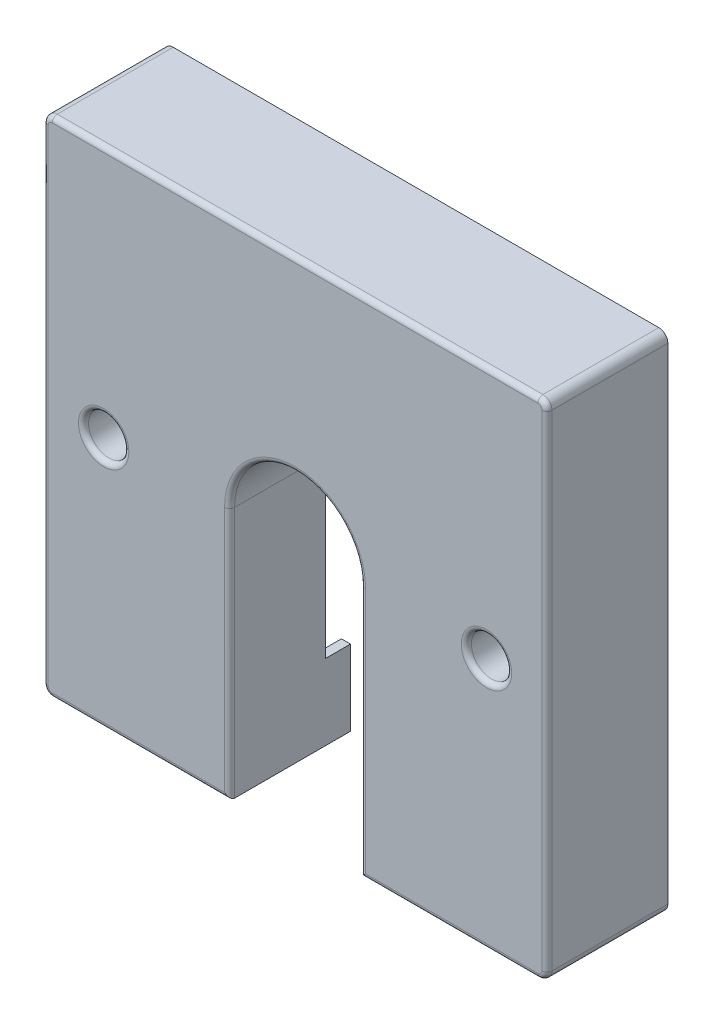
from build123d import *

# Parameters (mm, degrees)
SKETCH1_W           = 100
SKETCH1_H           = 100
BOSS_EXTRUDE1_DEPTH = 24
CUT_EXTRUDE1_DEPTH  = 127.818483233
CUT_EXTRUDE2_DEPTH  = 22
HOLE1_D             = 4
HOLE1_DEPTH         = 40
HOLE1_CBORE_D       = 8
HOLE1_CBORE_DEPTH   = 20
FILLET5_R           = 1
FILLET6_R           = 1
FILLET7_R           = 1.8
SKETCH10_W          = 46.470939908
SKETCH10_H          = 57.057613345
CUT_EXTRUDE4_DEPTH  = 5
FILLET8_R           = 1


with BuildPart() as part:
    # Sketch1 → Boss-Extrude1 (new body)
    with BuildSketch(Plane.XY.offset(121.301148811)):
        with Locations((24.455072694, 49.816681169)):
            Rectangle(SKETCH1_W, SKETCH1_H)
    extrude(amount=-BOSS_EXTRUDE1_DEPTH)

    # Sketch2 → Cut-Extrude1 (cut, through all)
    with BuildSketch(Plane(origin=(0, 0, 97.301148811), x_dir=(-1, 0, 0), z_dir=(0, 0, -1))):
        with BuildLine():
            Line((-37.455072694, -0.183318831), (-11.455072694, -0.183318831))
            Line((-11.455072694, -0.183318831), (-11.455072694, 49.816681169))
            ThreePointArc((-11.455072694, 49.816681169), (-24.455072694, 62.816681169), (-37.455072694, 49.816681169))
            Line((-37.455072694, 49.816681169), (-37.455072694, -0.183318831))
        make_face()
    extrude(amount=-CUT_EXTRUDE1_DEPTH, mode=Mode.SUBTRACT)

    # Sketch3 → Cut-Extrude2 (cut)
    with BuildSketch(Plane(origin=(0, 0, 97.301148811), x_dir=(-1, 0, 0), z_dir=(0, 0, -1))):
        with BuildLine():
            Line((-39.255072694, 1.616681169), (-39.255072694, 49.616681169))
            ThreePointArc((-39.255072694, 49.616681169), (-24.455072694, 64.416681169), (-9.655072694, 49.616681169))
            Line((-9.655072694, 49.616681169), (-9.655072694, 1.616681169))
            Line((-9.655072694, 1.616681169), (23.744927306, 1.616681169))
            Line((23.744927306, 1.616681169), (23.744927306, 98.016681169))
            Line((23.744927306, 98.016681169), (-72.655072694, 98.016681169))
            Line((-72.655072694, 98.016681169), (-72.655072694, 1.616681169))
            Line((-72.655072694, 1.616681169), (-39.255072694, 1.616681169))
        make_face()
    extrude(amount=-CUT_EXTRUDE2_DEPTH, mode=Mode.SUBTRACT)

    # Sketch4 → Revolve1 (revolve)
    with BuildSketch(Plane.XZ.offset(-49.816681169), mode=Mode.PRIVATE) as revolve1_sk:
        with BuildLine():
            Line((71.455072694, 120.301148811), (62.455072694, 120.301148811))
            Line((62.455072694, 120.301148811), (62.455072694, 97.301148811))
            Line((62.455072694, 97.301148811), (67.455072694, 97.301148811))
            Line((67.455072694, 97.301148811), (67.455072694, 116.301148811))
            ThreePointArc((67.455072694, 116.301148811), (68.626645569, 119.129575936), (71.455072694, 120.301148811))
        make_face()
    revolve(revolve1_sk.sketch.rotate(Axis((62.455072694, 49.816681169, 120.301148811), (0, 0, -1)), 180), axis=Axis((62.455072694, 49.816681169, 120.301148811), (0, 0, -1)))

    # Sketch5 → Revolve2 (revolve)
    with BuildSketch(Plane.XZ.offset(-49.816681169), mode=Mode.PRIVATE) as revolve2_sk:
        with BuildLine():
            Line((-4.544927306, 120.301148811), (-13.544927306, 120.301148811))
            Line((-13.544927306, 120.301148811), (-13.544927306, 97.301148811))
            Line((-13.544927306, 97.301148811), (-8.544927306, 97.301148811))
            Line((-8.544927306, 97.301148811), (-8.544927306, 116.301148811))
            ThreePointArc((-8.544927306, 116.301148811), (-7.373354431, 119.129575936), (-4.544927306, 120.301148811))
        make_face()
    revolve(revolve2_sk.sketch.rotate(Axis((-13.544927306, 49.816681169, 120.304302605), (0, 0, -1)), 180), axis=Axis((-13.544927306, 49.816681169, 120.304302605), (0, 0, -1)))

    # Hole1
    with Locations(Plane.XY.offset(121.301148811)):
        with Locations((-13.544927306, 49.816681169), (62.455072694, 49.816681169)):
            CounterBoreHole(HOLE1_D / 2, HOLE1_CBORE_D / 2, HOLE1_CBORE_DEPTH, depth=HOLE1_DEPTH)

    # Fillet5
    fillet5_edges = [part.edges().sort_by_distance(p)[0] for p in [
        (55.955072694, 1.616681169, 119.301148811),
        (72.655072694, 49.816681169, 119.301148811),
        (24.455072694, 98.016681169, 119.301148811),
        (-23.744927306, 49.816681169, 119.301148811),
        (-7.044927306, 1.616681169, 119.301148811),
        (9.655072694, 25.616681169, 119.301148811),
        (24.455072694, 64.416681169, 119.301148811),
        (39.255072694, 25.616681169, 119.301148811),
        (68.809321383, 49.816681169, 119.301148811),
        (-7.190678617, 49.816681169, 119.301148811),
    ]]
    fillet(fillet5_edges, radius=FILLET5_R)

    # Fillet6
    fillet6_edges = [part.edges().sort_by_distance(p)[0] for p in [
        (55.955072694, -0.183318831, 121.301148811),
        (37.455072694, 24.816681169, 121.301148811),
        (24.455072694, 62.816681169, 121.301148811),
        (11.455072694, 24.816681169, 121.301148811),
        (74.455072694, 49.816681169, 121.301148811),
        (-7.044927306, -0.183318831, 121.301148811),
        (-25.544927306, 49.816681169, 121.301148811),
        (24.455072694, 99.816681169, 121.301148811),
        (58.455072694, 49.816681169, 121.301148811),
        (-17.544927306, 49.816681169, 121.301148811),
    ]]
    fillet(fillet6_edges, radius=FILLET6_R)

    # Fillet7
    # the kernel refuses this fillet: 1.8 mm, written as the material it takes off along each edge
    with BuildSketch(Plane(origin=(-23.744927306, 98.016681169, 121.301148811), x_dir=(0, 1, 0), z_dir=(1, 0, 0))) as fillet7_piece_1:
        with BuildLine():
            CenterArc((0.8, -1), 1, 0, 90)
            Line((1.8, -1), (1.8, 0))
            Line((1.8, 0), (0.8, 0))
        make_face()
    revolve(axis=Axis((-23.744927306, 98.016681169, 121.301148811), (0, 0, 1)), revolution_arc=90, mode=Mode.SUBTRACT)
    with BuildSketch(Plane(origin=(72.655072694, 98.016681169, 121.301148811), x_dir=(1, 0, 0), z_dir=(0, -1, 0))) as fillet7_piece_2:
        with BuildLine():
            CenterArc((0.8, -1), 1, 0, 90)
            Line((1.8, -1), (1.8, 0))
            Line((1.8, 0), (0.8, 0))
        make_face()
    revolve(axis=Axis((72.655072694, 98.016681169, 121.301148811), (0, 0, 1)), revolution_arc=90, mode=Mode.SUBTRACT)
    with BuildSketch(Plane(origin=(-23.744927306, 1.616681169, 121.301148811), x_dir=(-1, 0, 0), z_dir=(0, 1, 0))) as fillet7_piece_3:
        with BuildLine():
            CenterArc((0.8, -1), 1, 0, 90)
            Line((1.8, -1), (1.8, 0))
            Line((1.8, 0), (0.8, 0))
        make_face()
    revolve(axis=Axis((-23.744927306, 1.616681169, 121.301148811), (0, 0, 1)), revolution_arc=90, mode=Mode.SUBTRACT)
    with BuildSketch(Plane(origin=(72.655072694, 1.616681169, 121.301148811), x_dir=(0, -1, 0), z_dir=(-1, 0, 0))) as fillet7_piece_4:
        with BuildLine():
            CenterArc((0.8, -1), 1, 0, 90)
            Line((1.8, -1), (1.8, 0))
            Line((1.8, 0), (0.8, 0))
        make_face()
    revolve(axis=Axis((72.655072694, 1.616681169, 121.301148811), (0, 0, 1)), revolution_arc=90, mode=Mode.SUBTRACT)
    with BuildSketch(Plane(origin=(74.455072694, 99.816681169, 121.301148811), x_dir=(-1, 0, 0), z_dir=(0, 0, -1)), Plane(origin=(74.455072694, -0.183318831, 121.301148811), x_dir=(0, 1, 0), z_dir=(0, 0, -1))) as fillet7_piece_5:
        with BuildLine():
            CenterArc((FILLET7_R, -FILLET7_R), FILLET7_R, 90, 90)
            Line((0, -FILLET7_R), (0, 0))
            Line((0, 0), (FILLET7_R, 0))
        make_face()
    extrude(amount=28.5, mode=Mode.SUBTRACT)
    with BuildSketch(Plane(origin=(-25.544927306, -0.183318831, 121.301148811), x_dir=(0, 1, 0), z_dir=(0, 0, -1)), Plane(origin=(-25.544927306, 99.816681169, 121.301148811), x_dir=(1, 0, 0), z_dir=(0, 0, -1))) as fillet7_piece_6:
        with BuildLine():
            CenterArc((FILLET7_R, FILLET7_R), FILLET7_R, 180, 90)
            Line((0, FILLET7_R), (0, 0))
            Line((0, 0), (FILLET7_R, 0))
        make_face()
    extrude(amount=28.5, mode=Mode.SUBTRACT)

    # Sketch10 → Cut-Extrude4 (cut)
    with BuildSketch(Plane(origin=(0, 0, 97.301148811), x_dir=(-1, 0, 0), z_dir=(0, 0, -1))):
        with Locations((-23.962820944, 43.345487842)):
            Rectangle(SKETCH10_W, SKETCH10_H)
    extrude(amount=-CUT_EXTRUDE4_DEPTH, mode=Mode.SUBTRACT)

    # Fillet8
    # the kernel refuses this fillet: 1 mm, written as the material it adds along each edge
    with BuildSketch(Plane(origin=(-22.744927306, 2.616681169, 118.301148811), x_dir=(0, -1, 0), z_dir=(-1, 0, 0))) as fillet8_piece_1_section:
        Polygon((0, 0), (FILLET8_R, 0), (FILLET8_R, FILLET8_R), (0, FILLET8_R), align=None)
    fillet8_piece_1 = extrude(amount=FILLET8_R, mode=Mode.PRIVATE)
    fillet8_piece_1 = fillet8_piece_1 - Plane(origin=(-22.744927306, 2.616681169, 118.301148811), x_dir=(0, 0.7071067811865475, -0.7071067811865475), z_dir=(-1, 0, 0)) * Sphere(FILLET8_R, mode=Mode.PRIVATE)
    add(fillet8_piece_1)
    with BuildSketch(Plane(origin=(-22.744927306, 97.016681169, 118.301148811), x_dir=(-1, 0, 0), z_dir=(0, 1, 0))) as fillet8_piece_2_section:
        Polygon((0, 0), (FILLET8_R, 0), (FILLET8_R, FILLET8_R), (0, FILLET8_R), align=None)
    fillet8_piece_2 = extrude(amount=FILLET8_R, mode=Mode.PRIVATE)
    fillet8_piece_2 = fillet8_piece_2 - Plane(origin=(-22.744927306, 97.016681169, 118.301148811), x_dir=(0.7071067811865475, 0, -0.7071067811865475), z_dir=(0, 1, 0)) * Sphere(FILLET8_R, mode=Mode.PRIVATE)
    add(fillet8_piece_2)
    with BuildSketch(Plane(origin=(71.655072694, 97.016681169, 118.301148811), x_dir=(0, 1, 0), z_dir=(1, 0, 0))) as fillet8_piece_3_section:
        Polygon((0, 0), (FILLET8_R, 0), (FILLET8_R, FILLET8_R), (0, FILLET8_R), align=None)
    fillet8_piece_3 = extrude(amount=FILLET8_R, mode=Mode.PRIVATE)
    fillet8_piece_3 = fillet8_piece_3 - Plane(origin=(71.655072694, 97.016681169, 118.301148811), x_dir=(0, -0.7071067811865475, -0.7071067811865475), z_dir=(1, 0, 0)) * Sphere(FILLET8_R, mode=Mode.PRIVATE)
    add(fillet8_piece_3)
    with BuildSketch(Plane(origin=(71.655072694, 2.616681169, 118.301148811), x_dir=(1, 0, 0), z_dir=(0, -1, 0))) as fillet8_piece_4_section:
        Polygon((0, 0), (FILLET8_R, 0), (FILLET8_R, FILLET8_R), (0, FILLET8_R), align=None)
    fillet8_piece_4 = extrude(amount=FILLET8_R, mode=Mode.PRIVATE)
    fillet8_piece_4 = fillet8_piece_4 - Plane(origin=(71.655072694, 2.616681169, 118.301148811), x_dir=(-0.7071067811865475, 0, -0.7071067811865475), z_dir=(0, -1, 0)) * Sphere(FILLET8_R, mode=Mode.PRIVATE)
    add(fillet8_piece_4)
    with BuildSketch(Plane(origin=(72.655072694, 1.616681169, 97.301148811), x_dir=(-1, 0, 0), z_dir=(0, 0, 1)), Plane(origin=(72.655072694, 98.016681169, 97.301148811), x_dir=(0, -1, 0), z_dir=(0, 0, 1)), Plane(origin=(-23.744927306, 98.016681169, 97.301148811), x_dir=(1, 0, 0), z_dir=(0, 0, 1)), Plane(origin=(-23.744927306, 1.616681169, 97.301148811), x_dir=(0, 1, 0), z_dir=(0, 0, 1))) as fillet8_piece_5:
        with BuildLine():
            CenterArc((FILLET8_R, -FILLET8_R), FILLET8_R, 90, 90)
            Line((0, -FILLET8_R), (0, 0))
            Line((0, 0), (FILLET8_R, 0))
        make_face()
    extrude(amount=21)


solid = part.part
